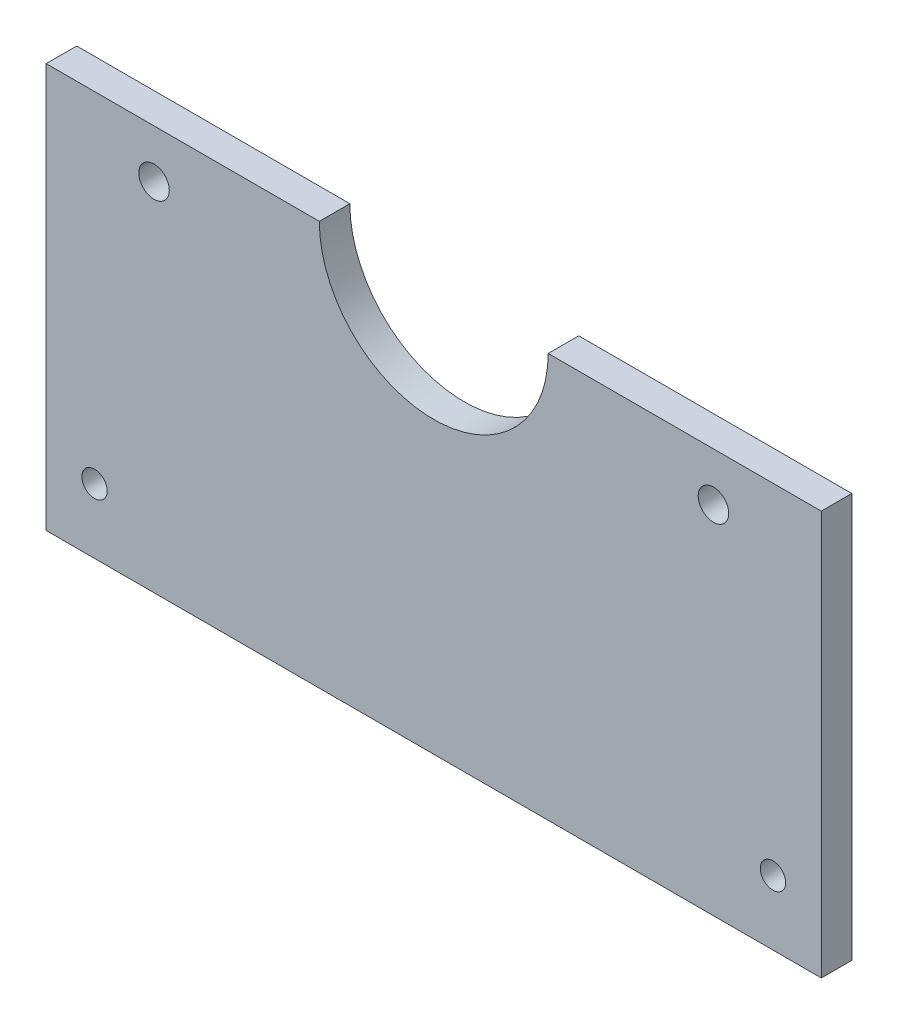
from build123d import *

# Parameters (mm, degrees)
SKETCH2_R           = 3
BOSS_EXTRUDE1_DEPTH = 3
SKETCH3_R           = 2.5
CUT_EXTRUDE1_DEPTH  = 6


with BuildPart() as part:
    # Sketch2 → Boss-Extrude1 (new, symmetric)
    with BuildSketch(Plane.XY):
        with BuildLine():
            Line((-76.2, 0), (76.2, 0))
            Line((76.2, 0), (76.2, 79.5))
            Line((76.2, 79.5), (22.5, 79.5))
            ThreePointArc((22.5, 79.5), (0, 57), (-22.5, 79.5))
            Line((-22.5, 79.5), (-76.2, 79.5))
            Line((-76.2, 79.5), (-76.2, 0))
        make_face()
        with Locations((-55, 70)):
            Circle(SKETCH2_R, mode=Mode.SUBTRACT)
        with Locations((55, 70)):
            Circle(SKETCH2_R, mode=Mode.SUBTRACT)
    extrude(amount=BOSS_EXTRUDE1_DEPTH, both=True)

    # Sketch3 → Cut-Extrude1 (cut)
    with BuildSketch(Plane.XY.offset(3)):
        with Locations((-66.7, 12.7)):
            Circle(SKETCH3_R)
        with Locations((66.7, 12.7)):
            Circle(SKETCH3_R)
    extrude(amount=-CUT_EXTRUDE1_DEPTH, mode=Mode.SUBTRACT)


solid = part.part
